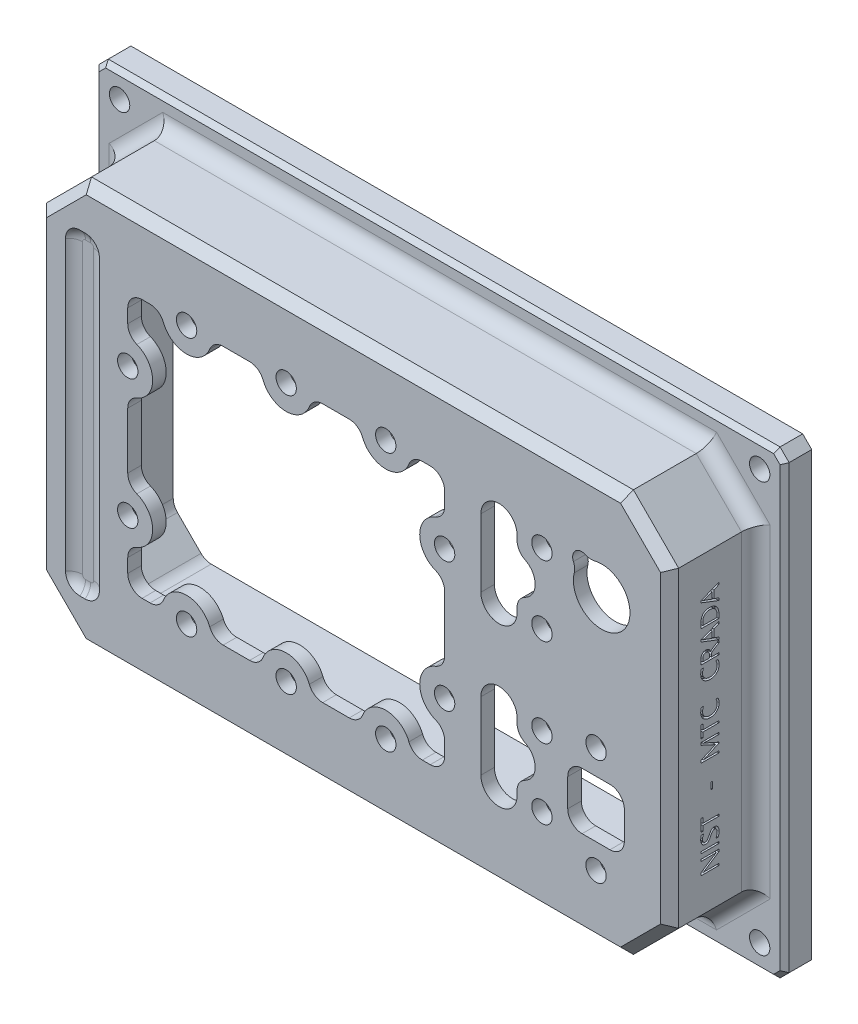
from build123d import *

# Parameters (mm, degrees)
SKETCH1_W                            = 152.4
SKETCH1_H                            = 101.6
FLANGE_BASE_DEPTH                    = 6
COVER_EXTERIOR_DEPTH                 = 19.05
F_4X_CLEARANCE_HOLE_M4_FLANGE_D      = 4.5
COVER_INTERIOR_DEPTH                 = 22.05
WINDOW_COVER_DEPTH                   = 185.867040059
F_10X_CLEARANCE_HOLE_M4_WINDOW_D     = 4.5
SKETCH8_W                            = 7.5
SKETCH8_H                            = 70
GROOVE_TOP_COVER_DEPTH               = 1.25
SKETCH9_W                            = 12.5
SKETCH9_H                            = 12.5
PORTS_TOP_COVER_DEPTH                = 185.867040059
F_2X_CLEARANCE_HOLE_M4_PORT_SQUARE_D = 4.5
F_4X_CLEARANCE_HOLE_M4_PORT_SLOTS_D  = 4.5
FILLET_3_175MM_FLANGE_R              = 3.175
FILLET_3_175MM_WINDOW_R              = 3.175
FILLET_3_175MM_PORTS_R               = 3.175
FILLET_3_175MM_GROOVE_R              = 3.175
FILLET_3MM_COVER_INTERIOR_R          = 3.175
CHAMFER_2MM_SIZE                     = 2
CHAMFER_1MM_SIZE                     = 1
SKETCH13_W                           = 3.950146484
SKETCH13_H                           = 0.40514323
SKETCH13_W_2                         = 0.354500326
SKETCH13_H_2                         = 1.468644205
ENGRAVING_TEXT_DEPTH                 = 0.8128


with BuildPart() as part:
    # Sketch1 → Flange, Base (new body)
    with BuildSketch(Plane.XY):
        with Locations((76.2, 50.8)):
            Rectangle(SKETCH1_W, SKETCH1_H)
    extrude(amount=FLANGE_BASE_DEPTH)

    # Sketch2 → Cover, Exterior (add)
    with BuildSketch(Plane.XY.offset(6)):
        Polygon((16.35, 95.25), (6.35, 85.25), (6.35, 16.35), (16.35, 6.35), (136.05, 6.35), (146.05, 16.35), (146.05, 85.25), (136.05, 95.25), align=None)
    extrude(amount=COVER_EXTERIOR_DEPTH)

    # 4X, Clearance Hole, M4, Flange (through all)
    with Locations(Plane.XY.offset(6)):
        with Locations((146.9, 5.5), (5.5, 5.5), (5.5, 96.1), (146.9, 96.1)):
            Hole(F_4X_CLEARANCE_HOLE_M4_FLANGE_D / 2)

    # Sketch5 → Cover, Interior (cut)
    with BuildSketch(Plane(origin=(0, 0, 0), x_dir=(-1, 0, 0), z_dir=(0, 0, -1))):
        Polygon((-11.35, 83.178932188), (-18.421067812, 90.25), (-133.978932188, 90.25), (-141.05, 83.178932188), (-141.05, 18.421067812), (-133.978932188, 11.35), (-18.421067812, 11.35), (-11.35, 18.421067812), align=None)
    extrude(amount=-COVER_INTERIOR_DEPTH, mode=Mode.SUBTRACT)

    # Sketch6 → Window, Cover (cut, through all)
    with BuildSketch(Plane.XY.offset(25.05)):
        with BuildLine():
            Line((26.35, 79.375), (33.85, 79.375))
            ThreePointArc((33.85, 79.375), (39.35, 73.875), (44.85, 79.375))
            Line((44.85, 79.375), (55.85, 79.375))
            ThreePointArc((55.85, 79.375), (61.35, 73.875), (66.85, 79.375))
            Line((66.85, 79.375), (77.85, 79.375))
            ThreePointArc((77.85, 79.375), (83.35, 73.875), (88.85, 79.375))
            Line((88.85, 79.375), (96.35, 79.375))
            Line((96.35, 79.375), (96.35, 70.5875))
            ThreePointArc((96.35, 70.5875), (90.85, 65.0875), (96.35, 59.5875))
            Line((96.35, 59.5875), (96.35, 42.0125))
            ThreePointArc((96.35, 42.0125), (90.85, 36.5125), (96.35, 31.0125))
            Line((96.35, 31.0125), (96.35, 22.225))
            Line((96.35, 22.225), (88.85, 22.225))
            ThreePointArc((88.85, 22.225), (83.35, 27.725), (77.85, 22.225))
            Line((77.85, 22.225), (66.85, 22.225))
            ThreePointArc((66.85, 22.225), (61.35, 27.725), (55.85, 22.225))
            Line((55.85, 22.225), (44.85, 22.225))
            ThreePointArc((44.85, 22.225), (39.35, 27.725), (33.85, 22.225))
            Line((33.85, 22.225), (26.35, 22.225))
            Line((26.35, 22.225), (26.35, 31.0125))
            ThreePointArc((26.35, 31.0125), (31.85, 36.5125), (26.35, 42.0125))
            Line((26.35, 42.0125), (26.35, 59.5875))
            ThreePointArc((26.35, 59.5875), (31.85, 65.0875), (26.35, 70.5875))
            Line((26.35, 70.5875), (26.35, 79.375))
        make_face()
    extrude(amount=-WINDOW_COVER_DEPTH, mode=Mode.SUBTRACT)

    # 10X, Clearance Hole, M4, Window (through all)
    with Locations(Plane(origin=(39.35, 22.225, 25.05), x_dir=(1, 0, 0), z_dir=(0, 0, 1))):
        with Locations((0, 0), (22, 0), (44, 0), (57, 14.2875), (57, 42.8625), (44, 57.15), (22, 57.15), (0, 57.15), (-13, 42.8625), (-13, 14.2875)):
            Hole(F_10X_CLEARANCE_HOLE_M4_WINDOW_D / 2)

    # Sketch8 → Groove, Top, Cover (cut)
    with BuildSketch(Plane.XY.offset(25.05)):
        with Locations((16.35, 50.8)):
            Rectangle(SKETCH8_W, SKETCH8_H)
    extrude(amount=-GROOVE_TOP_COVER_DEPTH, mode=Mode.SUBTRACT)

    # Sketch9 → Ports, Top, Cover (cut, through all)
    with BuildSketch(Plane.XY.offset(25.05)):
        with BuildLine():
            Line((112.35, 29.3), (112.35, 25.8))
            ThreePointArc((112.35, 25.8), (108.35, 21.8), (104.35, 25.8))
            Line((104.35, 25.8), (104.35, 40.8))
            ThreePointArc((104.35, 40.8), (108.35, 44.8), (112.35, 40.8))
            Line((112.35, 40.8), (112.35, 37.3))
            ThreePointArc((112.35, 37.3), (116.35, 33.3), (112.35, 29.3))
        make_face()
        with Locations((129.8, 32.05)):
            Rectangle(SKETCH9_W, SKETCH9_H)
        with BuildLine():
            Line((112.35, 75.8), (112.35, 72.3))
            ThreePointArc((112.35, 72.3), (116.35, 68.3), (112.35, 64.3))
            Line((112.35, 64.3), (112.35, 60.8))
            ThreePointArc((112.35, 60.8), (108.35, 56.8), (104.35, 60.8))
            Line((104.35, 60.8), (104.35, 75.8))
            ThreePointArc((104.35, 75.8), (108.35, 79.8), (112.35, 75.8))
        make_face()
        with BuildLine():
            ThreePointArc((125.460862518, 76.097148943), (135.469417382, 68.880582618), (128.252851057, 78.889137482))
            ThreePointArc((128.252851057, 78.889137482), (125.216369055, 79.133630945), (125.460862518, 76.097148943))
        make_face()
    extrude(amount=-PORTS_TOP_COVER_DEPTH, mode=Mode.SUBTRACT)

    # 2X, Clearance Hole, M4, Port, Square (through all)
    with Locations(Plane(origin=(129.8, 43.8, 25.05), x_dir=(1, 0, 0), z_dir=(0, 0, 1))):
        with Locations((0, 0), (0, -23.5)):
            Hole(F_2X_CLEARANCE_HOLE_M4_PORT_SQUARE_D / 2)

    # 4X, Clearance Hole, M4, Port, Slots (through all)
    with Locations(Plane(origin=(117.85, 76.045966692, 25.05), x_dir=(1, 0, 0), z_dir=(0, 0, 1))):
        with Locations((0, 0), (0, -15.491933384), (0, -35), (0, -50.491933384)):
            Hole(F_4X_CLEARANCE_HOLE_M4_PORT_SLOTS_D / 2)

    # Fillet, 3.175mm, Flange
    fillet_3_175mm_flange_edges = [part.edges().sort_by_distance(p)[0] for p in [
        (6.35, 50.8, 6),
        (11.35, 11.35, 6),
        (76.2, 6.35, 6),
        (141.05, 11.35, 6),
        (146.05, 50.8, 6),
        (141.05, 90.25, 6),
        (76.2, 95.25, 6),
        (11.35, 90.25, 6),
    ]]
    fillet(fillet_3_175mm_flange_edges, radius=FILLET_3_175MM_FLANGE_R)

    # Fillet, 3.175mm, Window
    fillet_3_175mm_window_edges = [part.edges().sort_by_distance(p)[0] for p in [
        (26.35, 79.375, 23.55),
        (33.85, 79.375, 23.55),
        (44.85, 79.375, 23.55),
        (55.85, 79.375, 23.55),
        (66.85, 79.375, 23.55),
        (77.85, 79.375, 23.55),
        (88.85, 79.375, 23.55),
        (96.35, 79.375, 23.55),
        (96.35, 70.5875, 23.55),
        (96.35, 59.5875, 23.55),
        (96.35, 42.0125, 23.55),
        (96.35, 31.0125, 23.55),
        (96.35, 22.225, 23.55),
        (88.85, 22.225, 23.55),
        (77.85, 22.225, 23.55),
        (66.85, 22.225, 23.55),
        (55.85, 22.225, 23.55),
        (44.85, 22.225, 23.55),
        (33.85, 22.225, 23.55),
        (26.35, 22.225, 23.55),
        (26.35, 31.0125, 23.55),
        (26.35, 42.0125, 23.55),
        (26.35, 59.5875, 23.55),
        (26.35, 70.5875, 23.55),
    ]]
    fillet(fillet_3_175mm_window_edges, radius=FILLET_3_175MM_WINDOW_R)

    # Fillet, 3.175mm, Ports
    fillet_3_175mm_ports_edges = [part.edges().sort_by_distance(p)[0] for p in [
        (12.6, 15.8, 24.425),
        (12.6, 85.8, 24.425),
        (20.1, 85.8, 24.425),
        (20.1, 15.8, 24.425),
        (123.55, 25.8, 23.55),
        (123.55, 38.3, 23.55),
        (136.05, 38.3, 23.55),
        (136.05, 25.8, 23.55),
        (125.460862518, 76.097148943, 23.55),
        (128.252851057, 78.889137482, 23.55),
        (112.35, 37.3, 23.55),
        (112.35, 29.3, 23.55),
        (112.35, 72.3, 23.55),
        (112.35, 64.3, 23.55),
    ]]
    fillet(fillet_3_175mm_ports_edges, radius=FILLET_3_175MM_PORTS_R)

    # Fillet, 3.175mm, Groove
    # the kernel refuses this fillet: 3.175 mm, written as the material it adds along each edge
    with BuildSketch(Plane(origin=(15.775, 82.625, 23.8), x_dir=(-1, 0, 0), z_dir=(0, -1, 0))) as fillet_3_175mm_groove_piece_1:
        with BuildLine():
            CenterArc((0.650123765, -3.175), FILLET_3_175MM_GROOVE_R, 37.322390296, 52.677609704)
            Line((0.650123765, 0), (0.650123765, 0.0635))
            Line((0.650123765, 0.0635), (3.175, 0.0635))
            Line((3.175, 0.0635), (3.2385, 0))
            ThreePointArc((3.2385, 0), (3.2385, -0.625), (3.225497525, -1.2115))
            Line((3.225497525, -1.2115), (3.175, -1.25))
        make_face()
    revolve(axis=Axis((15.775, 82.625, 23.8), (0, 0, -1)), revolution_arc=90)
    with BuildSketch(Plane(origin=(15.775, 85.8, 23.8), x_dir=(0, 0, 1), z_dir=(1, 0, 0)), Plane(origin=(16.925, 15.8, 23.8), x_dir=(0, 0, 1), z_dir=(-1, 0, 0))) as fillet_3_175mm_groove_piece_2:
        with BuildLine():
            CenterArc((3.175, 2.524876235), FILLET_3_175MM_GROOVE_R, 180, 52.677609704)
            Line((0, 2.524876235), (-0.0635, 2.524876235))
            Line((-0.0635, 2.524876235), (-0.0635, 0))
            Line((-0.0635, 0), (0, -0.0635))
            ThreePointArc((0, -0.0635), (0.625, -0.0635), (1.2115, -0.050497525))
            Line((1.2115, -0.050497525), (1.25, 0))
        make_face()
    extrude(amount=1.15)
    with BuildSketch(Plane(origin=(16.925, 82.625, 23.8), x_dir=(0, 1, 0), z_dir=(-1, 0, 0))) as fillet_3_175mm_groove_piece_3:
        with BuildLine():
            CenterArc((0.650123765, -3.175), FILLET_3_175MM_GROOVE_R, 37.322390296, 52.677609704)
            Line((0.650123765, 0), (0.650123765, 0.0635))
            Line((0.650123765, 0.0635), (3.175, 0.0635))
            Line((3.175, 0.0635), (3.2385, 0))
            ThreePointArc((3.2385, 0), (3.2385, -0.625), (3.225497525, -1.2115))
            Line((3.225497525, -1.2115), (3.175, -1.25))
        make_face()
    revolve(axis=Axis((16.925, 82.625, 23.8), (0, 0, -1)), revolution_arc=90)
    with BuildSketch(Plane(origin=(20.1, 82.625, 23.8), x_dir=(0, 0, 1), z_dir=(0, -1, 0)), Plane(origin=(12.6, 18.975, 23.8), x_dir=(0, 0, 1), z_dir=(0, 1, 0))) as fillet_3_175mm_groove_piece_4:
        with BuildLine():
            CenterArc((3.175, 2.524876235), FILLET_3_175MM_GROOVE_R, 180, 52.677609704)
            Line((0, 2.524876235), (-0.0635, 2.524876235))
            Line((-0.0635, 2.524876235), (-0.0635, 0))
            Line((-0.0635, 0), (0, -0.0635))
            ThreePointArc((0, -0.0635), (0.625, -0.0635), (1.2115, -0.050497525))
            Line((1.2115, -0.050497525), (1.25, 0))
        make_face()
    extrude(amount=63.65)
    with BuildSketch(Plane(origin=(16.925, 18.975, 23.8), x_dir=(0, -1, 0), z_dir=(-1, 0, 0))) as fillet_3_175mm_groove_piece_5:
        with BuildLine():
            CenterArc((0.650123765, 3.175), FILLET_3_175MM_GROOVE_R, 270, 52.677609704)
            Line((0.650123765, 0), (0.650123765, -0.0635))
            Line((0.650123765, -0.0635), (3.175, -0.0635))
            Line((3.175, -0.0635), (3.2385, 0))
            ThreePointArc((3.2385, 0), (3.2385, 0.625), (3.225497525, 1.2115))
            Line((3.225497525, 1.2115), (3.175, 1.25))
        make_face()
    revolve(axis=Axis((16.925, 18.975, 23.8), (0, 0, 1)), revolution_arc=90)
    with BuildSketch(Plane(origin=(15.775, 18.975, 23.8), x_dir=(-1, 0, 0), z_dir=(0, 1, 0))) as fillet_3_175mm_groove_piece_6:
        with BuildLine():
            CenterArc((0.650123765, 3.175), FILLET_3_175MM_GROOVE_R, 270, 52.677609704)
            Line((0.650123765, 0), (0.650123765, -0.0635))
            Line((0.650123765, -0.0635), (3.175, -0.0635))
            Line((3.175, -0.0635), (3.2385, 0))
            ThreePointArc((3.2385, 0), (3.2385, 0.625), (3.225497525, 1.2115))
            Line((3.225497525, 1.2115), (3.175, 1.25))
        make_face()
    revolve(axis=Axis((15.775, 18.975, 23.8), (0, 0, 1)), revolution_arc=90)

    # Fillet, 3mm, Cover, Interior
    fillet_3mm_cover_interior_edges = [part.edges().sort_by_distance(p)[0] for p in [
        (14.885533906, 86.714466094, 22.05),
        (18.421067812, 90.25, 11.025),
        (76.2, 90.25, 22.05),
        (133.978932188, 90.25, 11.025),
        (137.514466094, 86.714466094, 22.05),
        (141.05, 83.178932188, 11.025),
        (141.05, 50.8, 22.05),
        (141.05, 18.421067812, 11.025),
        (137.514466094, 14.885533906, 22.05),
        (133.978932188, 11.35, 11.025),
        (76.2, 11.35, 22.05),
        (18.421067812, 11.35, 11.025),
        (14.885533906, 14.885533906, 22.05),
        (11.35, 18.421067812, 11.025),
        (11.35, 50.8, 22.05),
        (11.35, 83.178932188, 11.025),
    ]]
    fillet(fillet_3mm_cover_interior_edges, radius=FILLET_3MM_COVER_INTERIOR_R)

    # Chamfer, 2mm
    chamfer_2mm_edges = [part.edges().sort_by_distance(p)[0] for p in [
        (6.35, 50.8, 25.05),
        (11.35, 11.35, 25.05),
        (76.2, 6.35, 25.05),
        (141.05, 11.35, 25.05),
        (146.05, 50.8, 25.05),
        (141.05, 90.25, 25.05),
        (76.2, 95.25, 25.05),
        (11.35, 90.25, 25.05),
        (0, 101.6, 3),
        (152.4, 101.6, 3),
        (152.4, 0, 3),
        (0, 0, 3),
    ]]
    chamfer(chamfer_2mm_edges, length=CHAMFER_2MM_SIZE)

    # Chamfer, 1mm
    chamfer_1mm_edges = [part.edges().sort_by_distance(p)[0] for p in [
        (76.2, 101.6, 6),
        (152.4, 50.8, 6),
        (0, 50.8, 6),
        (76.2, 0, 6),
        (1, 100.6, 6),
        (1, 1, 6),
        (151.4, 1, 6),
        (151.4, 100.6, 6),
    ]]
    chamfer(chamfer_1mm_edges, length=CHAMFER_1MM_SIZE)

    # Sketch13 → Engraving, Text (cut)
    # profile 1 of 13: a face of its own
    with BuildSketch(Plane(origin=(146.05, 0, 0), x_dir=(0, 0, -1), z_dir=(1, 0, 0))):
        with BuildLine():
            Line((-14.175, 27.073799642), (-14.175, 26.564205424))
            Line((-14.175, 26.564205424), (-17.371041997, 24.464898809))
            add(Edge.make_bspline(
                [(-17.371041997, 24.464898809), (-17.388589714, 24.453870112), (-17.424929386, 24.431030718), (-17.48415208, 24.399685499), (-17.548669603, 24.367599326), (-17.594842121, 24.348802492), (-17.618717448, 24.339082845)],
                knots=[0, 0, 0, 0, 0.893627632, 1.850618776, 2.888577403, 4, 4, 4, 4], degree=3))
            Line((-17.618717448, 24.339082845), (-17.618717448, 24.325630824))
            add(Edge.make_bspline(
                [(-17.618717448, 24.325630824), (-17.604743432, 24.326773789), (-17.574449742, 24.329251578), (-17.52508303, 24.331264536), (-17.468377362, 24.333672764), (-17.40429263, 24.336190579), (-17.333066533, 24.337721066), (-17.254721138, 24.338227085), (-17.169000344, 24.339328483), (-17.10938741, 24.339167104), (-17.078262711, 24.339082845)],
                knots=[0, 0, 0, 0, 0.622216159, 1.348876676, 2.192485707, 3.141373248, 4.195230468, 5.354246407, 6.618617129, 8, 8, 8, 8], degree=3))
            Line((-17.078262711, 24.339082845), (-14.175, 24.339082845))
            Line((-14.175, 24.339082845), (-14.175, 23.933939616))
            Line((-14.175, 23.933939616), (-18.125146484, 23.933939616))
            Line((-18.125146484, 23.933939616), (-18.125146484, 24.491011556))
            Line((-18.125146484, 24.491011556), (-14.991616821, 26.527014542))
            add(Edge.make_bspline(
                [(-14.991616821, 26.527014542), (-14.974421848, 26.53801422), (-14.941820282, 26.558869543), (-14.896419664, 26.589601485), (-14.854936187, 26.614084573), (-14.820203772, 26.636952933), (-14.790392768, 26.654734651), (-14.766097706, 26.669162568), (-14.747818732, 26.680588919), (-14.736598389, 26.685618497), (-14.73207194, 26.687647502)],
                knots=[0, 0, 0, 0, 1.604255624, 3.041658944, 4.307369394, 5.388506731, 6.30929538, 7.034544353, 7.610521251, 8, 8, 8, 8], degree=3))
            Line((-14.73207194, 26.687647502), (-14.73207194, 26.697934341))
            add(Edge.make_bspline(
                [(-14.73207194, 26.697934341), (-14.749460073, 26.6953841), (-14.785991586, 26.690026181), (-14.843910572, 26.68526906), (-14.907646758, 26.679012669), (-14.977621476, 26.675618038), (-15.053582344, 26.67241163), (-15.135351728, 26.66979042), (-15.223204182, 26.669535525), (-15.28386917, 26.668956167), (-15.315256627, 26.668656413)],
                knots=[0, 0, 0, 0, 0.721552806, 1.515942873, 2.3858434, 3.351444354, 4.392253989, 5.508461052, 6.710902694, 8, 8, 8, 8], degree=3))
            Line((-15.315256627, 26.668656413), (-18.125146484, 26.668656413))
            Line((-18.125146484, 26.668656413), (-18.125146484, 27.073799642))
            Line((-18.125146484, 27.073799642), (-14.175, 27.073799642))
        make_face()
    # profile 2 of 13: a face of its own
    with BuildSketch(Plane(origin=(146.05, 0, 0), x_dir=(0, 0, -1), z_dir=(1, 0, 0))):
        with Locations((-16.150073242, 28.339872233)):
            Rectangle(SKETCH13_W, SKETCH13_H)
    # profile 3 of 13: a face of its own
    with BuildSketch(Plane(origin=(146.05, 0, 0), x_dir=(0, 0, -1), z_dir=(1, 0, 0))):
        with BuildLine():
            add(Edge.make_bspline(
                [(-14.833357747, 29.454016113), (-14.810933215, 29.486506579), (-14.763956114, 29.55457078), (-14.706896104, 29.670858063), (-14.655103932, 29.801833387), (-14.611654546, 29.944962869), (-14.576408554, 30.093102879), (-14.548526409, 30.238412452), (-14.533370374, 30.378452827), (-14.530770621, 30.469744721), (-14.529500326, 30.514351908)],
                knots=[0, 0, 0, 0, 0.846452964, 1.773232316, 2.77208296, 3.868154266, 4.980527569, 6.039981904, 7.042292891, 8, 8, 8, 8], degree=3))
            add(Edge.make_bspline(
                [(-14.529500326, 30.514351908), (-14.529932958, 30.54918075), (-14.530772967, 30.61680519), (-14.537884397, 30.714827501), (-14.549726722, 30.806238468), (-14.565751656, 30.891075443), (-14.588244435, 30.968648297), (-14.614108788, 31.039815038), (-14.645118857, 31.104206065), (-14.680413084, 31.162635859), (-14.72192519, 31.213220322), (-14.767510829, 31.25780775), (-14.818490315, 31.294678811), (-14.873592448, 31.326351419), (-14.93419142, 31.349963642), (-14.999385357, 31.366150421), (-15.069063692, 31.377055289), (-15.11712471, 31.377972455), (-15.141962941, 31.378446452)],
                knots=[0, 0, 0, 0, 1.387448694, 2.693900732, 3.912587258, 5.058421495, 6.129439662, 7.12689455, 8.071586665, 8.972727521, 9.839260954, 10.671605474, 11.506003778, 12.338878791, 13.197475128, 14.086960817, 15.011329513, 16, 16, 16, 16], degree=3))
            add(Edge.make_bspline(
                [(-15.141962941, 31.378446452), (-15.170552039, 31.377524481), (-15.226446856, 31.375721926), (-15.307439123, 31.357364203), (-15.383359626, 31.329073903), (-15.453190916, 31.288851535), (-15.517386169, 31.239754082), (-15.577811618, 31.184613888), (-15.63264508, 31.12143875), (-15.674480676, 31.062183057), (-15.709149177, 31.007601944), (-15.738849418, 30.956183992), (-15.772947416, 30.89487976), (-15.811636231, 30.824016627), (-15.854132814, 30.743038313), (-15.901963249, 30.652887814), (-15.953278615, 30.552322804), (-15.988449076, 30.481676885), (-16.00684878, 30.444717916)],
                knots=[0, 0, 0, 0, 1.01667817, 1.987717208, 2.942073005, 3.892862143, 4.845413119, 5.816043117, 6.801381151, 7.818059321, 8.396609255, 9.103907621, 9.93239023, 10.895032119, 11.979212488, 13.189395744, 14.529610242, 16, 16, 16, 16], degree=3))
            add(Edge.make_bspline(
                [(-16.00684878, 30.444717916), (-16.030104599, 30.400024383), (-16.075108536, 30.313534847), (-16.143829241, 30.19022682), (-16.211024945, 30.077308349), (-16.277553522, 29.97534392), (-16.341991202, 29.883362577), (-16.40555286, 29.802426137), (-16.466855116, 29.73138867), (-16.528627141, 29.671143412), (-16.591476259, 29.619284128), (-16.657156035, 29.574992684), (-16.726647106, 29.537103598), (-16.80043456, 29.507508848), (-16.877681039, 29.483516884), (-16.958664543, 29.46608937), (-17.043693702, 29.455577618), (-17.101707379, 29.454543333), (-17.1312795, 29.454016113)],
                knots=[0, 0, 0, 0, 1.518393315, 2.938347519, 4.253975348, 5.477722369, 6.60701253, 7.63752037, 8.578296998, 9.432795184, 10.234877336, 11.030829842, 11.816915694, 12.615563126, 13.422711235, 14.252216256, 15.109077795, 16, 16, 16, 16], degree=3))
            add(Edge.make_bspline(
                [(-17.1312795, 29.454016113), (-17.170376821, 29.455290455), (-17.247159552, 29.457793117), (-17.359301026, 29.475734419), (-17.464794333, 29.508148247), (-17.564140347, 29.551488717), (-17.657402834, 29.607695618), (-17.743571337, 29.677128499), (-17.824187678, 29.758474395), (-17.896862196, 29.851669512), (-17.962293599, 29.953524051), (-18.019228834, 30.06219342), (-18.067794261, 30.176742549), (-18.107211714, 30.2972403), (-18.138006173, 30.423440307), (-18.16035588, 30.55535747), (-18.172727788, 30.693210907), (-18.174756756, 30.787061707), (-18.175789388, 30.834826533)],
                knots=[0, 0, 0, 0, 0.969222899, 1.903444508, 2.805387991, 3.698421643, 4.584388408, 5.496374487, 6.43504833, 7.417526811, 8.420615585, 9.432680486, 10.455337492, 11.501700351, 12.572262804, 13.673113267, 14.815744348, 16, 16, 16, 16], degree=3))
            add(Edge.make_bspline(
                [(-18.175789388, 30.834826533), (-18.175368358, 30.882313824), (-18.174556193, 30.973916575), (-18.167407228, 31.106179531), (-18.155791191, 31.228193202), (-18.139475989, 31.339718103), (-18.11833649, 31.440779871), (-18.092259557, 31.531241786), (-18.062393289, 31.611831152), (-18.036269125, 31.659609925), (-18.023860677, 31.682303874)],
                knots=[0, 0, 0, 0, 1.310121745, 2.52721841, 3.653248466, 4.690686254, 5.635577584, 6.499266339, 7.287181937, 8, 8, 8, 8], degree=3))
            Line((-18.023860677, 31.682303874), (-17.517431641, 31.682303874))
            add(Edge.make_bspline(
                [(-17.517431641, 31.682303874), (-17.537839984, 31.652620387), (-17.579054471, 31.592674821), (-17.629910472, 31.494670833), (-17.673639074, 31.390689773), (-17.709311008, 31.280020993), (-17.736815731, 31.162758963), (-17.756392587, 31.038987208), (-17.768527478, 30.908659859), (-17.769928336, 30.819555405), (-17.770646159, 30.77389679)],
                knots=[0, 0, 0, 0, 0.901025016, 1.819612908, 2.757737419, 3.722440357, 4.726625466, 5.769822488, 6.857219657, 8, 8, 8, 8], degree=3))
            add(Edge.make_bspline(
                [(-17.770646159, 30.77389679), (-17.770326526, 30.742746795), (-17.769702404, 30.681922676), (-17.760861693, 30.593017325), (-17.750208557, 30.508115863), (-17.731142316, 30.428319918), (-17.709541667, 30.352359489), (-17.681498253, 30.281080749), (-17.649234219, 30.213743125), (-17.612360565, 30.151172619), (-17.5704618, 30.094904424), (-17.524356402, 30.045450377), (-17.474419138, 30.003039891), (-17.420270677, 29.968854026), (-17.362240552, 29.942289567), (-17.300540796, 29.9233895), (-17.234819073, 29.912135261), (-17.189879556, 29.910591869), (-17.166887792, 29.909802246)],
                knots=[0, 0, 0, 0, 1.266297591, 2.472598641, 3.631705049, 4.742959013, 5.805451407, 6.84139923, 7.853805457, 8.839952818, 9.790444434, 10.701239882, 11.584450425, 12.447560658, 13.297232265, 14.172721029, 15.065135306, 16, 16, 16, 16], degree=3))
            add(Edge.make_bspline(
                [(-17.166887792, 29.909802246), (-17.14602841, 29.910200522), (-17.104943387, 29.910984973), (-17.044970322, 29.918855832), (-16.988163674, 29.93272417), (-16.934088852, 29.950552213), (-16.883000685, 29.974730404), (-16.834885667, 30.003757216), (-16.78997194, 30.038470229), (-16.74681253, 30.079089545), (-16.704437752, 30.128988194), (-16.659330989, 30.188287272), (-16.612047684, 30.259578617), (-16.560712258, 30.341397337), (-16.507052405, 30.434935247), (-16.45105021, 30.540057581), (-16.390768859, 30.655797061), (-16.35111308, 30.737654227), (-16.330488586, 30.780227153)],
                knots=[0, 0, 0, 0, 0.77990353, 1.536112407, 2.256331255, 2.964490532, 3.661778373, 4.365595399, 5.062115187, 5.780913816, 6.578095787, 7.507405743, 8.566283842, 9.776155305, 11.119691656, 12.598303188, 14.230818451, 16, 16, 16, 16], degree=3))
            add(Edge.make_bspline(
                [(-16.330488586, 30.780227153), (-16.305396178, 30.829931475), (-16.256899793, 30.925995586), (-16.183105353, 31.062937508), (-16.109231477, 31.186439727), (-16.037577556, 31.297785588), (-15.966104758, 31.396192895), (-15.89635756, 31.482794372), (-15.826576668, 31.555942119), (-15.757573103, 31.617158271), (-15.688200775, 31.66860834), (-15.618150086, 31.712930722), (-15.546487037, 31.749989361), (-15.474257649, 31.781970445), (-15.399502465, 31.803939278), (-15.32413714, 31.822070621), (-15.246975265, 31.832572361), (-15.195009808, 31.833676908), (-15.168866984, 31.834232585)],
                knots=[0, 0, 0, 0, 1.609612237, 3.110915983, 4.495779321, 5.768997548, 6.937314625, 8.010323223, 8.981086609, 9.856220565, 10.673642867, 11.475445225, 12.249651958, 13.004580809, 13.7546806, 14.498240735, 15.244493736, 16, 16, 16, 16], degree=3))
            add(Edge.make_bspline(
                [(-15.168866984, 31.834232585), (-15.127920237, 31.833281482), (-15.048008594, 31.831425311), (-14.931706582, 31.813675962), (-14.822918044, 31.784412665), (-14.720909325, 31.744156898), (-14.627629436, 31.690459757), (-14.540567699, 31.62671969), (-14.462365543, 31.549880968), (-14.39095832, 31.462600433), (-14.327899286, 31.365044079), (-14.27287667, 31.2582865), (-14.22763972, 31.142400447), (-14.189123942, 31.01824335), (-14.160402952, 30.884711369), (-14.139162069, 30.742542974), (-14.126284111, 30.591345506), (-14.125011734, 30.487737438), (-14.124357096, 30.434431076)],
                knots=[0, 0, 0, 0, 0.994507712, 1.940880566, 2.850463274, 3.727671945, 4.597425683, 5.458897333, 6.342801193, 7.253783017, 8.194255203, 9.160327251, 10.167274234, 11.213441525, 12.316068275, 13.482711842, 14.704854983, 16, 16, 16, 16], degree=3))
            add(Edge.make_bspline(
                [(-14.124357096, 30.434431076), (-14.125362457, 30.397754614), (-14.127506518, 30.319537317), (-14.13770839, 30.19554915), (-14.157940684, 30.058549372), (-14.181702535, 29.913728043), (-14.21092322, 29.772750168), (-14.24462, 29.647075453), (-14.280997691, 29.54168568), (-14.312569577, 29.481423714), (-14.326928711, 29.454016113)],
                knots=[0, 0, 0, 0, 0.873131826, 1.862066528, 2.958468332, 4.167984308, 5.354840096, 6.382754451, 7.264464431, 8, 8, 8, 8], degree=3))
            Line((-14.326928711, 29.454016113), (-14.833357747, 29.454016113))
        make_face()
    # profile 4 of 13: a face of its own
    with BuildSketch(Plane(origin=(146.05, 0, 0), x_dir=(0, 0, -1), z_dir=(1, 0, 0))):
        Polygon((-17.720003255, 34.872806803), (-17.720003255, 33.758662923), (-14.175, 33.758662923), (-14.175, 33.353519694), (-17.720003255, 33.353519694), (-17.720003255, 32.239375814), (-18.125146484, 32.239375814), (-18.125146484, 34.872806803), align=None)
    # profile 5 of 13: a face of its own
    with BuildSketch(Plane(origin=(146.05, 0, 0), x_dir=(0, 0, -1), z_dir=(1, 0, 0))):
        with Locations((-15.719608561, 40.013061523)):
            Rectangle(SKETCH13_W_2, SKETCH13_H_2)
    # profile 6 of 13: a face of its own
    with BuildSketch(Plane(origin=(146.05, 0, 0), x_dir=(0, 0, -1), z_dir=(1, 0, 0))):
        with BuildLine():
            Line((-14.175, 49.002176921), (-16.853534826, 49.002176921))
            add(Edge.make_bspline(
                [(-16.853534826, 49.002176921), (-16.908144, 49.002609629), (-17.023744519, 49.003525616), (-17.205991953, 49.012579872), (-17.406554663, 49.023755705), (-17.545943642, 49.035572329), (-17.618717448, 49.041741689)],
                knots=[0, 0, 0, 0, 0.854969074, 1.809858303, 2.856545566, 4, 4, 4, 4], degree=3))
            Line((-17.618717448, 49.041741689), (-17.618717448, 49.029080963))
            add(Edge.make_bspline(
                [(-17.618717448, 49.029080963), (-17.577531546, 49.01868282), (-17.501533177, 48.999495626), (-17.397688541, 48.971002507), (-17.313988983, 48.942749077), (-17.265711074, 48.922483145), (-17.244434738, 48.913551839)],
                knots=[0, 0, 0, 0, 1.299717072, 2.398305537, 3.294124607, 4, 4, 4, 4], degree=3))
            Line((-17.244434738, 48.913551839), (-14.175, 47.533532715))
            Line((-14.175, 47.533532715), (-14.175, 47.3309611))
            Line((-14.175, 47.3309611), (-17.222278468, 45.973889542))
            add(Edge.make_bspline(
                [(-17.222278468, 45.973889542), (-17.244834805, 45.964570686), (-17.296245118, 45.943331187), (-17.385709287, 45.916905953), (-17.495419767, 45.889475551), (-17.575406795, 45.871856889), (-17.618717448, 45.862316895)],
                knots=[0, 0, 0, 0, 0.709636107, 1.617399769, 2.709891152, 4, 4, 4, 4], degree=3))
            Line((-17.618717448, 45.862316895), (-17.618717448, 45.848864873))
            add(Edge.make_bspline(
                [(-17.618717448, 45.848864873), (-17.60395228, 45.850019408), (-17.569709595, 45.852696952), (-17.511102218, 45.854527637), (-17.438047057, 45.857015911), (-17.350743821, 45.859452297), (-17.248923713, 45.860978131), (-17.132598042, 45.861472026), (-17.001772434, 45.862565246), (-16.909717077, 45.862402323), (-16.861447779, 45.862316895)],
                knots=[0, 0, 0, 0, 0.469167865, 1.088072123, 1.857297772, 2.785230927, 3.855019937, 5.083484229, 6.470722694, 8, 8, 8, 8], degree=3))
            Line((-16.861447779, 45.862316895), (-14.175, 45.862316895))
            Line((-14.175, 45.862316895), (-14.175, 45.457173665))
            Line((-14.175, 45.457173665), (-18.125146484, 45.457173665))
            Line((-18.125146484, 45.457173665), (-18.125146484, 46.014245605))
            Line((-18.125146484, 46.014245605), (-15.350073624, 47.236796951))
            add(Edge.make_bspline(
                [(-15.350073624, 47.236796951), (-15.322936662, 47.248738337), (-15.271136023, 47.271532759), (-15.196342975, 47.303103615), (-15.128542921, 47.331952716), (-15.066789474, 47.356012786), (-15.012237008, 47.377948756), (-14.963755816, 47.3950599), (-14.92204747, 47.409819355), (-14.89590895, 47.417072883), (-14.884000651, 47.420377477)],
                knots=[0, 0, 0, 0, 1.419480801, 2.70958896, 3.886975172, 4.946959844, 5.882678436, 6.701599585, 7.408469151, 8, 8, 8, 8], degree=3))
            Line((-14.884000651, 47.420377477), (-14.884000651, 47.436203384))
            add(Edge.make_bspline(
                [(-14.884000651, 47.436203384), (-14.894551654, 47.440158518), (-14.918313219, 47.449065743), (-14.958025003, 47.463990012), (-15.005653729, 47.483277771), (-15.061307864, 47.505961473), (-15.124980937, 47.532460797), (-15.197187191, 47.561517569), (-15.277305033, 47.594652583), (-15.333458285, 47.617933177), (-15.36273435, 47.63007075)],
                knots=[0, 0, 0, 0, 0.523561194, 1.179094775, 1.971078505, 2.911015028, 3.971606011, 5.175531673, 6.527434934, 8, 8, 8, 8], degree=3))
            Line((-15.36273435, 47.63007075), (-18.125146484, 48.900891113))
            Line((-18.125146484, 48.900891113), (-18.125146484, 49.40732015))
            Line((-18.125146484, 49.40732015), (-14.175, 49.40732015))
            Line((-14.175, 49.40732015), (-14.175, 49.002176921))
        make_face()
    # profile 7 of 13: a face of its own
    with BuildSketch(Plane(origin=(146.05, 0, 0), x_dir=(0, 0, -1), z_dir=(1, 0, 0))):
        Polygon((-17.720003255, 52.74975179), (-17.720003255, 51.63560791), (-14.175, 51.63560791), (-14.175, 51.230464681), (-17.720003255, 51.230464681), (-17.720003255, 50.116320801), (-18.125146484, 50.116320801), (-18.125146484, 52.74975179), align=None)
    # profile 8 of 13: a face of its own
    with BuildSketch(Plane(origin=(146.05, 0, 0), x_dir=(0, 0, -1), z_dir=(1, 0, 0))):
        with BuildLine():
            add(Edge.make_bspline(
                [(-14.377571615, 56.092183431), (-14.357146158, 56.055048141), (-14.315811117, 55.979897374), (-14.265068167, 55.85988637), (-14.221222288, 55.733583874), (-14.185879852, 55.600490943), (-14.158213003, 55.460930473), (-14.138608943, 55.31479285), (-14.126526759, 55.162088938), (-14.125089399, 55.057983122), (-14.124357096, 55.004943593)],
                knots=[0, 0, 0, 0, 0.900334108, 1.822008111, 2.765255698, 3.740339547, 4.746393174, 5.787454655, 6.872758841, 8, 8, 8, 8], degree=3))
            add(Edge.make_bspline(
                [(-14.124357096, 55.004943593), (-14.126045268, 54.937080709), (-14.129354972, 54.804033823), (-14.154792207, 54.609678202), (-14.197815989, 54.42557829), (-14.256718213, 54.251460978), (-14.334322409, 54.08784939), (-14.428886793, 53.934546228), (-14.54040749, 53.791358074), (-14.667571114, 53.659678093), (-14.808124138, 53.541153481), (-14.960269609, 53.437850355), (-15.121790341, 53.349757582), (-15.293623082, 53.277963961), (-15.475302108, 53.222810002), (-15.667058912, 53.183428078), (-15.868541845, 53.159215763), (-16.006252526, 53.156354313), (-16.076482773, 53.15489502)],
                knots=[0, 0, 0, 0, 1.076510139, 2.110525129, 3.103305145, 4.072058517, 5.021160122, 5.970040267, 6.924349727, 7.895125778, 8.869269618, 9.83616817, 10.808089137, 11.783499633, 12.785620692, 13.815664692, 14.8860239, 16, 16, 16, 16], degree=3))
            add(Edge.make_bspline(
                [(-16.076482773, 53.15489502), (-16.150939031, 53.156515651), (-16.296897233, 53.15969261), (-16.510983276, 53.186165899), (-16.714761227, 53.230663454), (-16.909160299, 53.291165485), (-17.092917845, 53.371060249), (-17.267091005, 53.468008173), (-17.431524401, 53.582423084), (-17.584456436, 53.713387135), (-17.723040218, 53.857960494), (-17.84455842, 54.014226649), (-17.947054229, 54.180862984), (-18.030284581, 54.358138479), (-18.09691954, 54.544696148), (-18.141855658, 54.742102924), (-18.170547348, 54.949237044), (-18.17401636, 55.090832567), (-18.175789388, 55.163202667)],
                knots=[0, 0, 0, 0, 1.096715353, 2.149914661, 3.172078793, 4.166382941, 5.144578477, 6.11878275, 7.098705866, 8.09093464, 9.080420004, 10.044299692, 11.002057351, 11.956403068, 12.924924898, 13.914684945, 14.934186224, 16, 16, 16, 16], degree=3))
            add(Edge.make_bspline(
                [(-18.175789388, 55.163202667), (-18.175350193, 55.208843487), (-18.174489018, 55.298336114), (-18.167263944, 55.429533347), (-18.155505397, 55.554938455), (-18.139028113, 55.674305756), (-18.117823307, 55.787651173), (-18.091549026, 55.894848851), (-18.061296734, 55.996291775), (-18.036158658, 56.060682418), (-18.023860677, 56.092183431)],
                knots=[0, 0, 0, 0, 1.156489919, 2.267648153, 3.328454044, 4.347437676, 5.320124273, 6.249019161, 7.143389983, 8, 8, 8, 8], degree=3))
            Line((-18.023860677, 56.092183431), (-17.568074544, 56.092183431))
            add(Edge.make_bspline(
                [(-17.568074544, 56.092183431), (-17.584362887, 56.056770458), (-17.617014033, 55.985782623), (-17.657682785, 55.875622893), (-17.692798849, 55.76289673), (-17.721228776, 55.647139724), (-17.743408967, 55.528253249), (-17.759048812, 55.406463022), (-17.768886005, 55.281795844), (-17.770055047, 55.197774256), (-17.770646159, 55.155289714)],
                knots=[0, 0, 0, 0, 0.96749784, 1.939418551, 2.912992658, 3.897779793, 4.897093106, 5.91410379, 6.945290764, 8, 8, 8, 8], degree=3))
            add(Edge.make_bspline(
                [(-17.770646159, 55.155289714), (-17.769436488, 55.097707844), (-17.767074204, 54.985260157), (-17.744018675, 54.821300745), (-17.708342915, 54.666201059), (-17.656345349, 54.520408373), (-17.590428794, 54.383433851), (-17.509986554, 54.255065363), (-17.414571624, 54.135679984), (-17.304403683, 54.027266392), (-17.183803977, 53.929081868), (-17.053248334, 53.844302841), (-16.914941129, 53.772001013), (-16.768569719, 53.712208744), (-16.613714316, 53.666396369), (-16.450507385, 53.634370273), (-16.279311776, 53.613911692), (-16.162266109, 53.611771987), (-16.10259552, 53.610681152)],
                knots=[0, 0, 0, 0, 1.079614412, 2.10830501, 3.09967663, 4.060610912, 5.005602913, 5.946036828, 6.89654438, 7.865736758, 8.840219802, 9.809159523, 10.780774066, 11.763961821, 12.770626558, 13.805084693, 14.881018901, 16, 16, 16, 16], degree=3))
            add(Edge.make_bspline(
                [(-16.10259552, 53.610681152), (-16.045574552, 53.611919692), (-15.933872065, 53.614345957), (-15.770515918, 53.63265854), (-15.615290492, 53.663344875), (-15.46858512, 53.706954648), (-15.329802154, 53.762413283), (-15.199701814, 53.830699543), (-15.077685738, 53.91117889), (-14.964864293, 54.003349816), (-14.863151779, 54.106263694), (-14.772473482, 54.216874205), (-14.698353186, 54.337856779), (-14.63572791, 54.465495903), (-14.588646241, 54.602296213), (-14.55327126, 54.746508331), (-14.533845339, 54.899700968), (-14.530971784, 55.0043651), (-14.529500326, 55.057960383)],
                knots=[0, 0, 0, 0, 1.137162008, 2.227668694, 3.273886737, 4.289279499, 5.275999999, 6.250243084, 7.214749633, 8.186802671, 9.150318664, 10.096851242, 11.032620065, 11.973815561, 12.927224262, 13.912316463, 14.930961451, 16, 16, 16, 16], degree=3))
            add(Edge.make_bspline(
                [(-14.529500326, 55.057960383), (-14.530385005, 55.106792443), (-14.532129537, 55.203086153), (-14.546771283, 55.345088038), (-14.570355109, 55.482362376), (-14.603493978, 55.614690669), (-14.646395299, 55.741964681), (-14.69891385, 55.864116995), (-14.760131297, 55.981818051), (-14.808949948, 56.055396505), (-14.833357747, 56.092183431)],
                knots=[0, 0, 0, 0, 1.070106145, 2.110181118, 3.125275816, 4.120821421, 5.097094118, 6.065736613, 7.032928786, 8, 8, 8, 8], degree=3))
            Line((-14.833357747, 56.092183431), (-14.377571615, 56.092183431))
        make_face()
    # profile 9 of 13: a face of its own
    with BuildSketch(Plane(origin=(146.05, 0, 0), x_dir=(0, 0, -1), z_dir=(1, 0, 0))):
        with BuildLine():
            add(Edge.make_bspline(
                [(-14.377571615, 63.43540446), (-14.357146158, 63.39826917), (-14.315811117, 63.323118402), (-14.265068167, 63.203107398), (-14.221222288, 63.076804903), (-14.185879852, 62.943711972), (-14.158213003, 62.804151502), (-14.138608943, 62.658013879), (-14.126526759, 62.505309967), (-14.125089399, 62.40120415), (-14.124357096, 62.348164622)],
                knots=[0, 0, 0, 0, 0.900334108, 1.822008111, 2.765255698, 3.740339547, 4.746393174, 5.787454655, 6.872758841, 8, 8, 8, 8], degree=3))
            add(Edge.make_bspline(
                [(-14.124357096, 62.348164622), (-14.126045268, 62.280301738), (-14.129354972, 62.147254851), (-14.154792207, 61.952899231), (-14.197815989, 61.768799319), (-14.256718213, 61.594682007), (-14.334322409, 61.431070419), (-14.428886793, 61.277767256), (-14.54040749, 61.134579103), (-14.667571114, 61.002899122), (-14.808124138, 60.884374509), (-14.960269609, 60.781071384), (-15.121790341, 60.692978611), (-15.293623082, 60.62118499), (-15.475302108, 60.566031031), (-15.667058912, 60.526649106), (-15.868541845, 60.502436792), (-16.006252526, 60.499575342), (-16.076482773, 60.498116048)],
                knots=[0, 0, 0, 0, 1.076510139, 2.110525129, 3.103305145, 4.072058517, 5.021160122, 5.970040267, 6.924349727, 7.895125778, 8.869269618, 9.83616817, 10.808089137, 11.783499633, 12.785620692, 13.815664692, 14.8860239, 16, 16, 16, 16], degree=3))
            add(Edge.make_bspline(
                [(-16.076482773, 60.498116048), (-16.150939031, 60.49973668), (-16.296897233, 60.502913638), (-16.510983276, 60.529386927), (-16.714761227, 60.573884483), (-16.909160299, 60.634386514), (-17.092917845, 60.714281278), (-17.267091005, 60.811229202), (-17.431524401, 60.925644112), (-17.584456436, 61.056608164), (-17.723040218, 61.201181523), (-17.84455842, 61.357447678), (-17.947054229, 61.524084013), (-18.030284581, 61.701359508), (-18.09691954, 61.887917176), (-18.141855658, 62.085323953), (-18.170547348, 62.292458073), (-18.17401636, 62.434053596), (-18.175789388, 62.506423696)],
                knots=[0, 0, 0, 0, 1.096715353, 2.149914661, 3.172078793, 4.166382941, 5.144578477, 6.11878275, 7.098705866, 8.09093464, 9.080420004, 10.044299692, 11.002057351, 11.956403068, 12.924924898, 13.914684945, 14.934186224, 16, 16, 16, 16], degree=3))
            add(Edge.make_bspline(
                [(-18.175789388, 62.506423696), (-18.175350193, 62.552064516), (-18.174489018, 62.641557143), (-18.167263944, 62.772754376), (-18.155505397, 62.898159483), (-18.139028113, 63.017526784), (-18.117823307, 63.130872202), (-18.091549026, 63.23806988), (-18.061296734, 63.339512803), (-18.036158658, 63.403903447), (-18.023860677, 63.43540446)],
                knots=[0, 0, 0, 0, 1.156489919, 2.267648153, 3.328454044, 4.347437676, 5.320124273, 6.249019161, 7.143389983, 8, 8, 8, 8], degree=3))
            Line((-18.023860677, 63.43540446), (-17.568074544, 63.43540446))
            add(Edge.make_bspline(
                [(-17.568074544, 63.43540446), (-17.584362887, 63.399991486), (-17.617014033, 63.329003651), (-17.657682785, 63.218843922), (-17.692798849, 63.106117759), (-17.721228776, 62.990360753), (-17.743408967, 62.871474278), (-17.759048812, 62.74968405), (-17.768886005, 62.625016873), (-17.770055047, 62.540995284), (-17.770646159, 62.498510742)],
                knots=[0, 0, 0, 0, 0.96749784, 1.939418551, 2.912992658, 3.897779793, 4.897093106, 5.91410379, 6.945290764, 8, 8, 8, 8], degree=3))
            add(Edge.make_bspline(
                [(-17.770646159, 62.498510742), (-17.769436488, 62.440928873), (-17.767074204, 62.328481186), (-17.744018675, 62.164521774), (-17.708342915, 62.009422087), (-17.656345349, 61.863629402), (-17.590428794, 61.726654879), (-17.509986554, 61.598286392), (-17.414571624, 61.478901013), (-17.304403683, 61.370487421), (-17.183803977, 61.272302897), (-17.053248334, 61.18752387), (-16.914941129, 61.115222041), (-16.768569719, 61.055429773), (-16.613714316, 61.009617398), (-16.450507385, 60.977591302), (-16.279311776, 60.95713272), (-16.162266109, 60.954993015), (-16.10259552, 60.953902181)],
                knots=[0, 0, 0, 0, 1.079614412, 2.10830501, 3.09967663, 4.060610912, 5.005602913, 5.946036828, 6.89654438, 7.865736758, 8.840219802, 9.809159523, 10.780774066, 11.763961821, 12.770626558, 13.805084693, 14.881018901, 16, 16, 16, 16], degree=3))
            add(Edge.make_bspline(
                [(-16.10259552, 60.953902181), (-16.045574552, 60.955140721), (-15.933872065, 60.957566986), (-15.770515918, 60.975879568), (-15.615290492, 61.006565904), (-15.46858512, 61.050175677), (-15.329802154, 61.105634312), (-15.199701814, 61.173920572), (-15.077685738, 61.254399919), (-14.964864293, 61.346570845), (-14.863151779, 61.449484722), (-14.772473482, 61.560095233), (-14.698353186, 61.681077808), (-14.63572791, 61.808716931), (-14.588646241, 61.945517242), (-14.55327126, 62.089729359), (-14.533845339, 62.242921997), (-14.530971784, 62.347586128), (-14.529500326, 62.401181412)],
                knots=[0, 0, 0, 0, 1.137162008, 2.227668694, 3.273886737, 4.289279499, 5.275999999, 6.250243084, 7.214749633, 8.186802671, 9.150318664, 10.096851242, 11.032620065, 11.973815561, 12.927224262, 13.912316463, 14.930961451, 16, 16, 16, 16], degree=3))
            add(Edge.make_bspline(
                [(-14.529500326, 62.401181412), (-14.530385005, 62.450013472), (-14.532129537, 62.546307181), (-14.546771283, 62.688309066), (-14.570355109, 62.825583405), (-14.603493978, 62.957911697), (-14.646395299, 63.085185709), (-14.69891385, 63.207338024), (-14.760131297, 63.325039079), (-14.808949948, 63.398617533), (-14.833357747, 63.43540446)],
                knots=[0, 0, 0, 0, 1.070106145, 2.110181118, 3.125275816, 4.120821421, 5.097094118, 6.065736613, 7.032928786, 8, 8, 8, 8], degree=3))
            Line((-14.833357747, 63.43540446), (-14.377571615, 63.43540446))
        make_face()
    # profile 10 of 13: a face of its own
    with BuildSketch(Plane(origin=(146.05, 0, 0), x_dir=(0, 0, -1), z_dir=(1, 0, 0))):
        with BuildLine():
            Line((-14.175, 67.031050618), (-14.175, 66.524621582))
            Line((-14.175, 66.524621582), (-15.273317973, 65.851229223))
            add(Edge.make_bspline(
                [(-15.273317973, 65.851229223), (-15.301449401, 65.833819983), (-15.35571558, 65.800237153), (-15.431300725, 65.747501781), (-15.500742462, 65.69788953), (-15.562596837, 65.649124357), (-15.616358547, 65.600609002), (-15.663351363, 65.554303953), (-15.702400156, 65.508957643), (-15.744989051, 65.450817608), (-15.786515076, 65.373694444), (-15.821592731, 65.273323911), (-15.842228165, 65.163906045), (-15.844859687, 65.087982348), (-15.84621582, 65.048855718)],
                knots=[0, 0, 0, 0, 1.142658844, 2.204215515, 3.182998758, 4.09092829, 4.923332808, 5.683638546, 6.368567432, 6.988261197, 8.170737107, 9.378261409, 10.648909335, 12, 12, 12, 12], degree=3))
            Line((-15.84621582, 65.048855718), (-15.84621582, 64.650834147))
            Line((-15.84621582, 64.650834147), (-14.175, 64.650834147))
            Line((-14.175, 64.650834147), (-14.175, 64.245690918))
            Line((-14.175, 64.245690918), (-18.125146484, 64.245690918))
            Line((-18.125146484, 64.245690918), (-18.125146484, 65.398608271))
            add(Edge.make_bspline(
                [(-18.125146484, 65.398608271), (-18.124129592, 65.442421291), (-18.122140498, 65.528121782), (-18.109700151, 65.653339136), (-18.087836883, 65.7718034), (-18.055737872, 65.882765046), (-18.016670729, 65.987369836), (-17.966957832, 66.084378734), (-17.90922153, 66.174969364), (-17.842830988, 66.258205385), (-17.768302601, 66.332515088), (-17.687427071, 66.398004801), (-17.599348158, 66.452908983), (-17.505119164, 66.498521285), (-17.403476755, 66.531920046), (-17.296400062, 66.557631727), (-17.182360279, 66.572879305), (-17.104157823, 66.574455489), (-17.064019394, 66.575264486)],
                knots=[0, 0, 0, 0, 1.173996503, 2.29639675, 3.367909805, 4.3969756, 5.387985548, 6.355195848, 7.311943058, 8.262299309, 9.201845344, 10.126817244, 11.044551361, 11.977106668, 12.924752159, 13.905323732, 14.924880126, 16, 16, 16, 16], degree=3))
            add(Edge.make_bspline(
                [(-17.064019394, 66.575264486), (-17.030226972, 66.574763056), (-16.964059614, 66.57378123), (-16.867300767, 66.562976331), (-16.775112543, 66.546785498), (-16.687413644, 66.522969677), (-16.604627244, 66.491749223), (-16.52523484, 66.455872749), (-16.451681272, 66.410736269), (-16.381809295, 66.360260946), (-16.316474409, 66.302927294), (-16.256079178, 66.238511208), (-16.200892571, 66.166795783), (-16.149274143, 66.089235048), (-16.102422101, 66.004844562), (-16.060539069, 65.913532352), (-16.023462457, 65.815293122), (-16.002515854, 65.746902315), (-15.991814168, 65.711961238)],
                knots=[0, 0, 0, 0, 1.08293557, 2.120445412, 3.117321602, 4.081488841, 5.028670623, 5.951803385, 6.869809318, 7.789954901, 8.712739011, 9.651998252, 10.616165491, 11.610599762, 12.636465061, 13.707248472, 14.828626083, 16, 16, 16, 16], degree=3))
            Line((-15.991814168, 65.711961238), (-15.981527328, 65.711961238))
            add(Edge.make_bspline(
                [(-15.981527328, 65.711961238), (-15.969199816, 65.738656174), (-15.944985591, 65.791091504), (-15.899147751, 65.862887281), (-15.84933487, 65.928710141), (-15.801387484, 65.978287138), (-15.756783411, 66.015586587), (-15.718120983, 66.047816194), (-15.671860976, 66.081335177), (-15.619676389, 66.118580028), (-15.561300071, 66.158964717), (-15.496097411, 66.201493964), (-15.425145734, 66.247550591), (-15.375195998, 66.278367153), (-15.349282328, 66.29435463)],
                knots=[0, 0, 0, 0, 1.207878789, 2.372566934, 3.494184454, 4.598731909, 5.198738077, 5.884825213, 6.667964234, 7.546809396, 8.521619546, 9.586580091, 10.747929999, 12, 12, 12, 12], degree=3))
            Line((-15.349282328, 66.29435463), (-14.175, 67.031050618))
        make_face()
        with BuildLine():
            Line((-17.720003255, 64.650834147), (-16.251359049, 64.650834147))
            Line((-16.251359049, 64.650834147), (-16.251359049, 65.301278941))
            add(Edge.make_bspline(
                [(-16.251359049, 65.301278941), (-16.251865621, 65.33111875), (-16.252859538, 65.389665908), (-16.263627933, 65.475112913), (-16.279793046, 65.556304031), (-16.303776624, 65.632905831), (-16.334619361, 65.704982714), (-16.372217051, 65.772696467), (-16.415650306, 65.836488085), (-16.466426822, 65.894821085), (-16.522253522, 65.947338308), (-16.582115264, 65.99437286), (-16.647107151, 66.032590543), (-16.715833983, 66.064895033), (-16.788676347, 66.089183639), (-16.865820679, 66.106529704), (-16.946818811, 66.118133654), (-17.002521067, 66.119025713), (-17.030784988, 66.119478353)],
                knots=[0, 0, 0, 0, 1.125769891, 2.208815373, 3.245660858, 4.247051833, 5.232778741, 6.199824888, 7.166409646, 8.140503061, 9.112457065, 10.056420024, 11.007497068, 11.951827502, 12.918412259, 13.898996998, 14.9339286, 16, 16, 16, 16], degree=3))
            add(Edge.make_bspline(
                [(-17.030784988, 66.119478353), (-17.057206066, 66.119010203), (-17.108679307, 66.118098159), (-17.183489628, 66.106950116), (-17.254249183, 66.091854477), (-17.320512447, 66.068856291), (-17.381550382, 66.038117384), (-17.439306689, 66.002831805), (-17.491579593, 65.959573623), (-17.539367927, 65.910221463), (-17.582026518, 65.85470667), (-17.61950076, 65.793587247), (-17.6502899, 65.726488768), (-17.675487685, 65.653786946), (-17.696347311, 65.575351009), (-17.710211646, 65.490819704), (-17.717921692, 65.400598732), (-17.719294523, 65.338748555), (-17.720003255, 65.306818008)],
                knots=[0, 0, 0, 0, 1.046927883, 2.039612901, 2.993852357, 3.913580246, 4.81181887, 5.70001141, 6.5920765, 7.49462966, 8.419459606, 9.363147647, 10.331954749, 11.341039859, 12.411789853, 13.546835116, 14.733538031, 16, 16, 16, 16], degree=3))
            Line((-17.720003255, 65.306818008), (-17.720003255, 64.650834147))
        make_face(mode=Mode.SUBTRACT)
    # profile 11 of 13: a face of its own
    with BuildSketch(Plane(origin=(146.05, 0, 0), x_dir=(0, 0, -1), z_dir=(1, 0, 0))):
        Polygon((-14.175, 70.626696777), (-14.175, 70.170910645), (-15.28914388, 69.739654668), (-15.28914388, 68.039952215), (-14.175, 67.638765462), (-14.175, 67.132336426), (-18.125146484, 68.651623535), (-18.125146484, 69.056766764), align=None)
        with BuildLine():
            Line((-15.694287109, 69.540248235), (-17.40823288, 68.912751007))
            add(Edge.make_bspline(
                [(-17.40823288, 68.912751007), (-17.425299168, 68.906941309), (-17.462180363, 68.89438623), (-17.523270739, 68.880290467), (-17.59306646, 68.865580298), (-17.642933094, 68.858138824), (-17.669360352, 68.85419515)],
                knots=[0, 0, 0, 0, 0.806681847, 1.74328419, 2.804033753, 4, 4, 4, 4], degree=3))
            Line((-17.669360352, 68.85419515), (-17.669360352, 68.840743128))
            add(Edge.make_bspline(
                [(-17.669360352, 68.840743128), (-17.640542219, 68.83605405), (-17.587456615, 68.827416343), (-17.515354352, 68.811012815), (-17.45619707, 68.796822648), (-17.422882682, 68.782810126), (-17.40823288, 68.776648204)],
                knots=[0, 0, 0, 0, 1.299255028, 2.393345149, 3.293483183, 4, 4, 4, 4], degree=3))
            Line((-17.40823288, 68.776648204), (-15.694287109, 68.154690043))
            Line((-15.694287109, 68.154690043), (-15.694287109, 69.540248235))
        make_face(mode=Mode.SUBTRACT)
    # profile 12 of 13: a face of its own
    with BuildSketch(Plane(origin=(146.05, 0, 0), x_dir=(0, 0, -1), z_dir=(1, 0, 0))):
        with BuildLine():
            Line((-14.175, 71.183768717), (-18.125146484, 71.183768717))
            Line((-18.125146484, 71.183768717), (-18.125146484, 72.24964358))
            add(Edge.make_bspline(
                [(-18.125146484, 72.24964358), (-18.123561224, 72.333301533), (-18.120484874, 72.495647741), (-18.098682954, 72.731417338), (-18.060650607, 72.95089774), (-18.009405177, 73.154750695), (-17.94076974, 73.341605493), (-17.858786565, 73.513336957), (-17.760287802, 73.668554557), (-17.646455501, 73.807172383), (-17.517801822, 73.929775734), (-17.373385683, 74.035313678), (-17.214142202, 74.125337432), (-17.039598157, 74.197712903), (-16.850706518, 74.255181687), (-16.646482217, 74.294473461), (-16.427396161, 74.319701982), (-16.27622696, 74.322293535), (-16.19834226, 74.323628743)],
                knots=[0, 0, 0, 0, 1.236802442, 2.400132668, 3.496432437, 4.527385333, 5.503239875, 6.434602175, 7.33575777, 8.214044087, 9.08016923, 9.956071545, 10.851878687, 11.778198328, 12.744122403, 13.765874081, 14.848943917, 16, 16, 16, 16], degree=3))
            add(Edge.make_bspline(
                [(-16.19834226, 74.323628743), (-16.123605084, 74.321846999), (-15.977555138, 74.318365147), (-15.764305909, 74.289935134), (-15.562145037, 74.244543566), (-15.371242178, 74.179593327), (-15.192186424, 74.09526144), (-15.024887578, 73.992358247), (-14.868653999, 73.871342466), (-14.725614789, 73.732177083), (-14.595903604, 73.579233805), (-14.483180455, 73.413879584), (-14.38765197, 73.238134744), (-14.310027326, 73.05159853), (-14.248476966, 72.854666818), (-14.206799674, 72.646424388), (-14.179619718, 72.42787565), (-14.176561934, 72.278478712), (-14.175, 72.202165858)],
                knots=[0, 0, 0, 0, 1.087219121, 2.124622608, 3.124649048, 4.09812917, 5.052789847, 5.998768933, 6.950794758, 7.922578392, 8.89763118, 9.864307488, 10.829557755, 11.803310251, 12.80003859, 13.826814645, 14.889923854, 16, 16, 16, 16], degree=3))
            Line((-14.175, 72.202165858), (-14.175, 71.183768717))
        make_face()
        with BuildLine():
            Line((-17.720003255, 71.588911947), (-14.580143229, 71.588911947))
            Line((-14.580143229, 71.588911947), (-14.580143229, 72.192670314))
            add(Edge.make_bspline(
                [(-14.580143229, 72.192670314), (-14.581241345, 72.257081873), (-14.583384581, 72.382796366), (-14.603423527, 72.565684455), (-14.636259782, 72.737618978), (-14.683113346, 72.898100653), (-14.74228003, 73.047918657), (-14.815422517, 73.186492551), (-14.902098065, 73.314013473), (-15.00199842, 73.429412706), (-15.113125495, 73.533075513), (-15.235793641, 73.622670679), (-15.368725879, 73.699458995), (-15.512962952, 73.760830766), (-15.667143207, 73.809455544), (-15.831865582, 73.842830758), (-16.006829776, 73.863908942), (-16.127062584, 73.86650736), (-16.188846715, 73.867842611)],
                knots=[0, 0, 0, 0, 1.171273207, 2.286018517, 3.341735411, 4.351368101, 5.322465432, 6.266776081, 7.195615554, 8.120867155, 9.037470655, 9.953885792, 10.87805458, 11.823644082, 12.799329002, 13.813658661, 14.876502986, 16, 16, 16, 16], degree=3))
            add(Edge.make_bspline(
                [(-16.188846715, 73.867842611), (-16.250630578, 73.866795299), (-16.370841542, 73.864757576), (-16.5448699, 73.844211712), (-16.707482883, 73.81348276), (-16.857572026, 73.768323764), (-16.996029297, 73.710400075), (-17.122468075, 73.638942365), (-17.237021971, 73.55477738), (-17.339909297, 73.457751053), (-17.429959244, 73.347442421), (-17.508268598, 73.224180011), (-17.573777445, 73.088044052), (-17.627521748, 72.939248905), (-17.669275313, 72.777624371), (-17.699095137, 72.603227205), (-17.71620582, 72.41589397), (-17.718711652, 72.286869741), (-17.720003255, 72.220365651)],
                knots=[0, 0, 0, 0, 1.149191579, 2.235946763, 3.256287445, 4.225207895, 5.146827608, 6.043580097, 6.921202744, 7.785730248, 8.668075267, 9.564008024, 10.496954868, 11.473589509, 12.50335438, 13.599149502, 14.76250859, 16, 16, 16, 16], degree=3))
            Line((-17.720003255, 72.220365651), (-17.720003255, 71.588911947))
        make_face(mode=Mode.SUBTRACT)
    # profile 13 of 13: a face of its own
    with BuildSketch(Plane(origin=(146.05, 0, 0), x_dir=(0, 0, -1), z_dir=(1, 0, 0))):
        Polygon((-14.175, 78.121846517), (-14.175, 77.666060384), (-15.28914388, 77.234804408), (-15.28914388, 75.535101954), (-14.175, 75.133915202), (-14.175, 74.627486165), (-18.125146484, 76.146773275), (-18.125146484, 76.551916504), align=None)
        with BuildLine():
            Line((-15.694287109, 77.035397975), (-17.40823288, 76.407900747))
            add(Edge.make_bspline(
                [(-17.40823288, 76.407900747), (-17.425299168, 76.402091049), (-17.462180363, 76.38953597), (-17.523270739, 76.375440206), (-17.59306646, 76.360730038), (-17.642933094, 76.353288563), (-17.669360352, 76.349344889)],
                knots=[0, 0, 0, 0, 0.806681847, 1.74328419, 2.804033753, 4, 4, 4, 4], degree=3))
            Line((-17.669360352, 76.349344889), (-17.669360352, 76.335892868))
            add(Edge.make_bspline(
                [(-17.669360352, 76.335892868), (-17.640542219, 76.331203789), (-17.587456615, 76.322566082), (-17.515354352, 76.306162554), (-17.45619707, 76.291972388), (-17.422882682, 76.277959866), (-17.40823288, 76.271797943)],
                knots=[0, 0, 0, 0, 1.299255028, 2.393345149, 3.293483183, 4, 4, 4, 4], degree=3))
            Line((-17.40823288, 76.271797943), (-15.694287109, 75.649839783))
            Line((-15.694287109, 75.649839783), (-15.694287109, 77.035397975))
        make_face(mode=Mode.SUBTRACT)
    extrude(amount=-ENGRAVING_TEXT_DEPTH, mode=Mode.SUBTRACT)


solid = part.part
